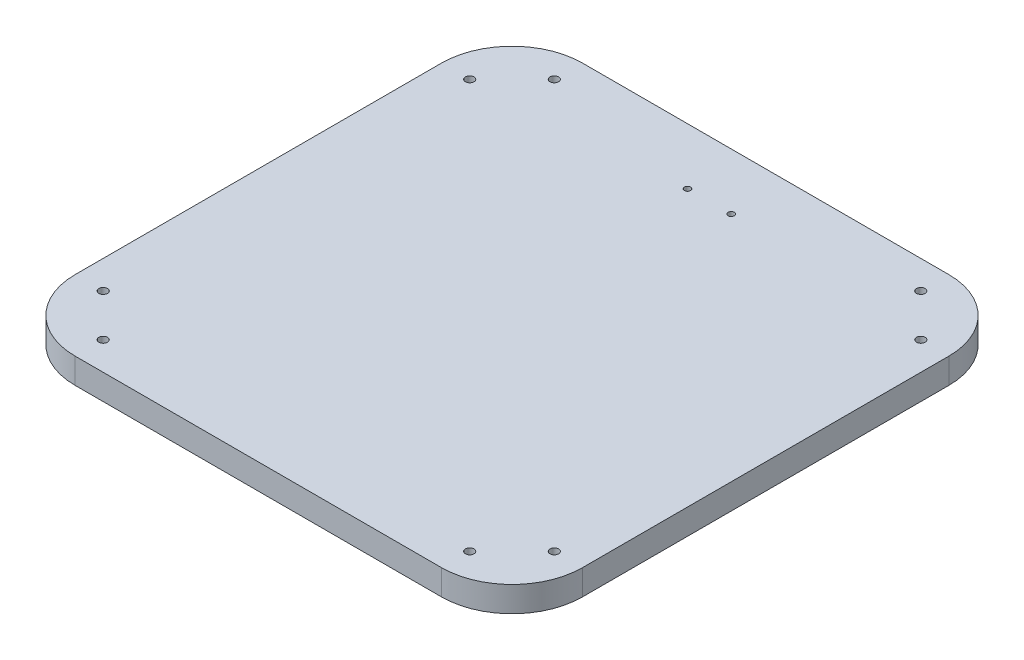
from build123d import *

# Parameters (mm, degrees)
PLATE_DEPTH        = 9
SKETCH2_R          = 1.09
CASTER_HOLES_DEPTH = 128.597021909
SKETCH3_R          = 1.525
HEX_HOLES_DEPTH    = 128.597021909


with BuildPart() as part:
    # Sketch1 → Plate (new body)
    with BuildSketch(Plane(origin=(0, 0, 0), x_dir=(1, 0, 0), z_dir=(0, 1, 0))):
        with BuildLine():
            Line((-65, -90), (65, -90))
            ThreePointArc((65, -90), (82.67766953, -82.67766953), (90, -65))
            Line((90, -65), (90, 65))
            ThreePointArc((90, 65), (82.67766953, 82.67766953), (65, 90))
            Line((65, 90), (-65, 90))
            ThreePointArc((-65, 90), (-82.67766953, 82.67766953), (-90, 65))
            Line((-90, 65), (-90, -65))
            ThreePointArc((-90, -65), (-82.67766953, -82.67766953), (-65, -90))
        make_face()
    extrude(amount=PLATE_DEPTH)

    # Sketch2 → Caster Holes (cut, through all)
    with BuildSketch(Plane(origin=(0, 9, 0), x_dir=(1, 0, 0), z_dir=(0, 1, 0))):
        with Locations((-7.747, 70)):
            Circle(SKETCH2_R)
        with Locations((7.747, 70)):
            Circle(SKETCH2_R)
    extrude(amount=-CASTER_HOLES_DEPTH, mode=Mode.SUBTRACT)

    # Sketch3 → Hex Holes (cut, through all)
    with BuildSketch(Plane(origin=(0, 9, 0), x_dir=(1, 0, 0), z_dir=(0, 1, 0))):
        with Locations((-65, 80)):
            Circle(SKETCH3_R)
        with Locations((-80, 65)):
            Circle(SKETCH3_R)
        with Locations((80, 65)):
            Circle(SKETCH3_R)
        with Locations((80, -65)):
            Circle(SKETCH3_R)
        with Locations((65, 80)):
            Circle(SKETCH3_R)
        with Locations((65, -80)):
            Circle(SKETCH3_R)
        with Locations((-65, -80)):
            Circle(SKETCH3_R)
        with Locations((-80, -65)):
            Circle(SKETCH3_R)
    extrude(amount=-HEX_HOLES_DEPTH, mode=Mode.SUBTRACT)


solid = part.part
